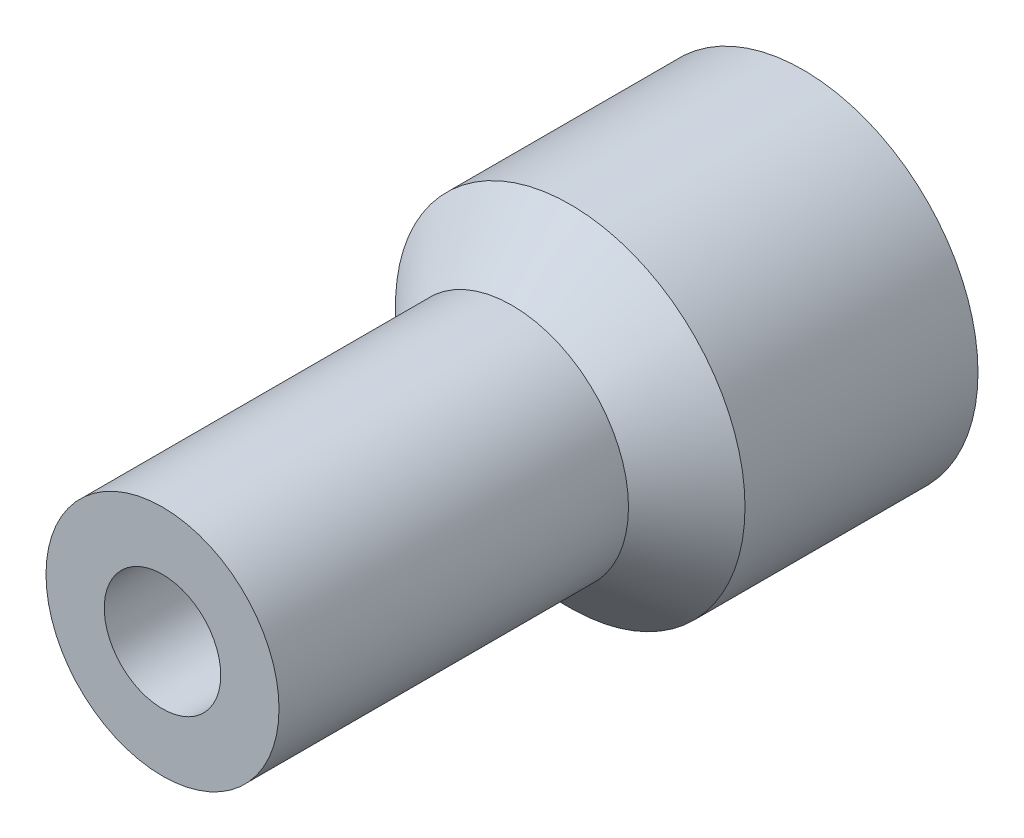
from build123d import *

# Parameters (mm, degrees)
BASE_SKETCH_R           = 3
BASE_SKETCH_R_2         = 2
EXTRUDE_PIN_THICK_DEPTH = 4
BASE_SKETCH_3_R         = 2
BASE_SKETCH_3_R_2       = 1
EXTRUDE_PIN_THIN_DEPTH  = 11
CHAMFER_2_SIZE          = 1


with BuildPart() as part:
    # Base Sketch → Extrude Pin Thick (new body)
    with BuildSketch(Plane.XY):
        Circle(BASE_SKETCH_R)
        Circle(BASE_SKETCH_R_2, mode=Mode.SUBTRACT)
    extrude(amount=EXTRUDE_PIN_THICK_DEPTH)

    # Base Sketch<3> → Extrude Pin Thin (add)
    with BuildSketch(Plane.XY):
        Circle(BASE_SKETCH_3_R)
        Circle(BASE_SKETCH_3_R_2, mode=Mode.SUBTRACT)
    extrude(amount=EXTRUDE_PIN_THIN_DEPTH)

    # Chamfer 2
    chamfer_2_edges = [part.edges().sort_by_distance(p)[0] for p in [
        (-2, 0, 4),
    ]]
    chamfer(chamfer_2_edges, length=CHAMFER_2_SIZE - 0.0001)  # a hair under: the kernel refuses the full size


solid = part.part
